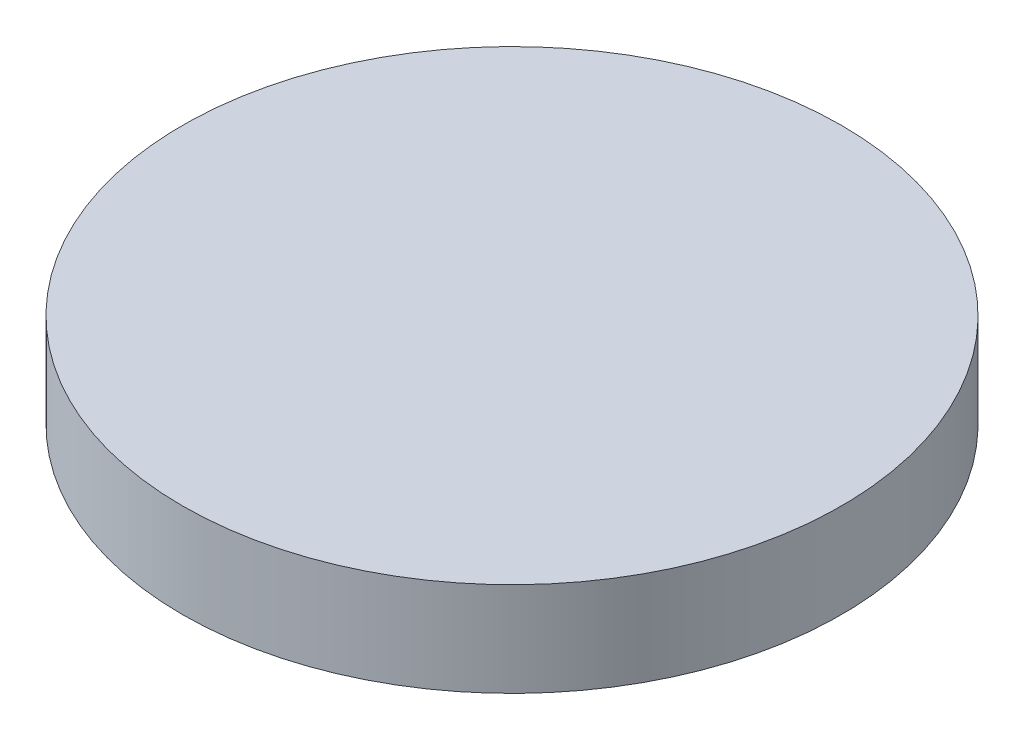
from build123d import *

# Parameters (mm, degrees)
SKETCH7_R           = 14
SKETCH7_R_2         = 13
BOSS_EXTRUDE2_DEPTH = 4
BOSS_EXTRUDE6_START = 3.5
SKETCH7_3_R         = 14
BOSS_EXTRUDE6_DEPTH = 0.5
THREAD3_PITCH       = 1


with BuildPart() as part:
    # Sketch7 → Boss-Extrude2 (new body)
    with BuildSketch(Plane(origin=(0, 0, 0), x_dir=(1, 0, 0), z_dir=(0, 1, 0))):
        with Locations(Location((40, 0, 0), (0, 0, 270))):
            Circle(SKETCH7_R)
        with Locations(Location((40, 0, 0), (0, 0, 270))):
            Circle(SKETCH7_R_2, mode=Mode.SUBTRACT)
    extrude(amount=BOSS_EXTRUDE2_DEPTH)

    # Sketch7<3> → Boss-Extrude6 (add)
    with BuildSketch(Plane(origin=(0, 0, 0), x_dir=(1, 0, 0), z_dir=(0, 1, 0)).offset(BOSS_EXTRUDE6_START)):
        with Locations(Location((40, 0, 0), (0, 0, 270))):
            Circle(SKETCH7_3_R)
    extrude(amount=BOSS_EXTRUDE6_DEPTH)

    # Thread3: arcs per turn and ends read off the stored shape
    # Thread3: the profile of Thread Profile3 profile screwed along a right-hand helix through 4 turns, 8 arcs to a turn; built about Z, then put on its axis
    thread3_z = Axis((0, 0, 0), (0, 0, 1))
    thread3_corners = [(12.9997, 0, -0.000173205), (13.541265875, 0, 0.312499999), (13.541265875, 0, 0.437499999), (12.9997, 0, 0.750173202)]
    with BuildLine(mode=Mode.PRIVATE) as thread3_profile:
        Line(thread3_corners[0], thread3_corners[1])
        Line(thread3_corners[1], thread3_corners[2])
        Line(thread3_corners[2], thread3_corners[3])
        Line(thread3_corners[3], thread3_corners[0])
    thread3_cap = Face(thread3_profile.wire())
    thread3_turn_angles = [0, 22.5, 45, 67.5, 90, 112.5, 135, 157.5, 180, 202.5, 225, 247.5, 270, 292.5, 315, 337.5, 360]
    thread3_turn_weights = [1, 0.9238795325112867, 1, 0.9238795325112867, 1, 0.9238795325112867, 1, 0.9238795325112867, 1, 0.9238795325112867, 1, 0.9238795325112867, 1, 0.9238795325112867, 1, 0.9238795325112867, 1]
    thread3_turn_rails = [Edge.make_bspline([Vector(p[0], p[1], 0).rotate(thread3_z, thread3_turn_angles[k]) / thread3_turn_weights[k] + Vector(0, 0, p[2] + THREAD3_PITCH * thread3_turn_angles[k] / 360) for k in range(17)], [0, 0, 0, 1, 1, 2, 2, 3, 3, 4, 4, 5, 5, 6, 6, 7, 7, 8, 8, 8], 2, thread3_turn_weights) for p in thread3_corners]
    thread3_turn_sides = [Face.make_surface_from_curves(thread3_turn_rails[p[0]], thread3_turn_rails[p[1]]) for p in [(0, 1), (1, 2), (2, 3), (3, 0)]]
    thread3 = Plane(origin=(40, 3.5, 0), x_dir=(-1, 0, 0), z_dir=(0, -1, 0)) * Solid(Shell([*[p.moved(Location((0, 0, THREAD3_PITCH * i))) for i in range(4) for p in thread3_turn_sides], thread3_cap, thread3_cap.rotate(thread3_z, 1440).moved(Location((0, 0, THREAD3_PITCH * 1440 / 360)))]))
    add(thread3, mode=Mode.SUBTRACT)


solid = part.part
